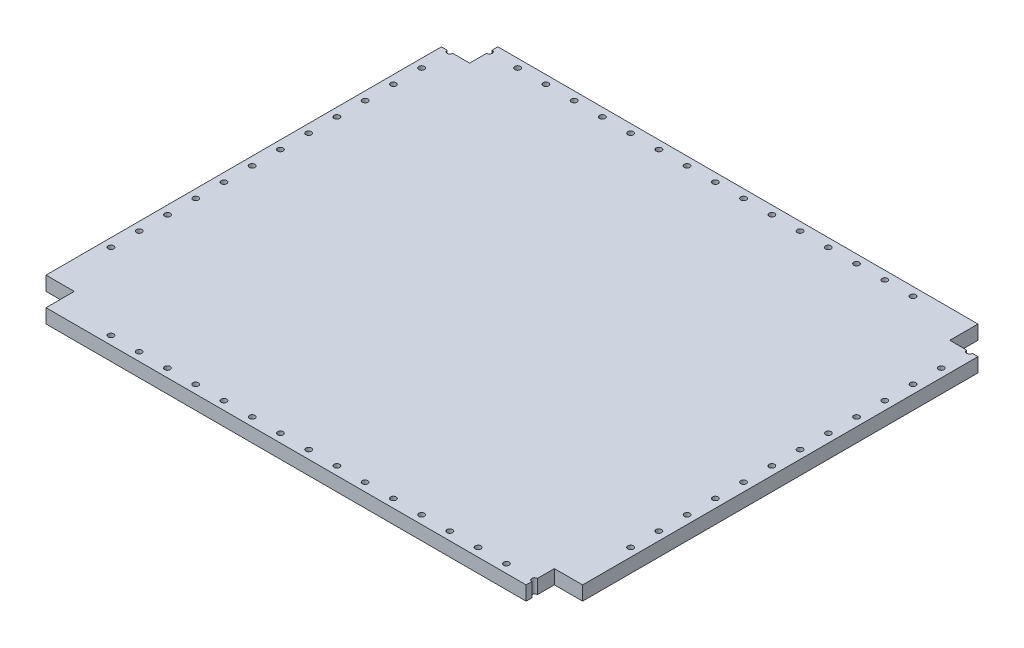
from build123d import *

# Parameters (mm, degrees)
SKETCH1_W           = 482.6
SKETCH1_H           = 406.4
BOSS_EXTRUDE1_DEPTH = 12.7
SKETCH2_R           = 2.5
CUT_EXTRUDE1_DEPTH  = 316.716993524
LPATTERN1_COUNT     = 13
LPATTERN1_PITCH     = 25.4
SKETCH3_R           = 2.5
CUT_EXTRUDE2_DEPTH  = 316.716993524
LPATTERN2_COUNT     = 16
LPATTERN2_PITCH     = 25.4
SKETCH4_R           = 2.5
CUT_EXTRUDE3_DEPTH  = 316.716993524
LPATTERN3_COUNT     = 13
LPATTERN3_PITCH     = 25.4
SKETCH5_R           = 2.5
CUT_EXTRUDE4_DEPTH  = 316.716993524
LPATTERN4_COUNT     = 16
LPATTERN4_PITCH     = 25.4
SKETCH6_W           = 25.4
SKETCH6_H           = 25.4
CUT_EXTRUDE5_DEPTH  = 316.716993524
SKETCH7_W           = 25.4
SKETCH7_H           = 25.4
CUT_EXTRUDE6_DEPTH  = 316.716993524
SKETCH8_W           = 25.4
SKETCH8_H           = 25.4
CUT_EXTRUDE7_DEPTH  = 316.716993524
SKETCH9_W           = 25.4
SKETCH9_H           = 25.4
CUT_EXTRUDE8_DEPTH  = 316.716993524


with BuildPart() as part:
    # Sketch1 → Boss-Extrude1 (new body)
    with BuildSketch(Plane(origin=(0, 0, 0), x_dir=(1, 0, 0), z_dir=(0, 1, 0))):
        Rectangle(SKETCH1_W, SKETCH1_H)
    extrude(amount=BOSS_EXTRUDE1_DEPTH)

    # Sketch2 → Cut-Extrude1 (cut, through all)
    with BuildSketch(Plane(origin=(0, 12.7, 0), x_dir=(1, 0, 0), z_dir=(0, 1, 0))):
        with Locations((-233.68, 177.8)):
            Circle(SKETCH2_R)
    cut_extrude1 = extrude(amount=-CUT_EXTRUDE1_DEPTH, mode=Mode.SUBTRACT)

    # LPattern1: Cut-Extrude1 ×13
    with Locations(*[(0, 0, i * LPATTERN1_PITCH) for i in range(1, LPATTERN1_COUNT)]):
        add(cut_extrude1, mode=Mode.SUBTRACT)

    # Sketch3 → Cut-Extrude2 (cut, through all)
    with BuildSketch(Plane(origin=(0, 12.7, 0), x_dir=(1, 0, 0), z_dir=(0, 1, 0))):
        with Locations((-215.9, 195.58)):
            Circle(SKETCH3_R)
    cut_extrude2 = extrude(amount=-CUT_EXTRUDE2_DEPTH, mode=Mode.SUBTRACT)

    # LPattern2: Cut-Extrude2 ×16
    with Locations(*[(i * LPATTERN2_PITCH, 0, 0) for i in range(1, LPATTERN2_COUNT)]):
        add(cut_extrude2, mode=Mode.SUBTRACT)

    # Sketch4 → Cut-Extrude3 (cut, through all)
    with BuildSketch(Plane(origin=(0, 12.7, 0), x_dir=(1, 0, 0), z_dir=(0, 1, 0))):
        with Locations((233.68, 177.8)):
            Circle(SKETCH4_R)
    cut_extrude3 = extrude(amount=-CUT_EXTRUDE3_DEPTH, mode=Mode.SUBTRACT)

    # LPattern3: Cut-Extrude3 ×13
    with Locations(*[(0, 0, i * LPATTERN3_PITCH) for i in range(1, LPATTERN3_COUNT)]):
        add(cut_extrude3, mode=Mode.SUBTRACT)

    # Sketch5 → Cut-Extrude4 (cut, through all)
    with BuildSketch(Plane(origin=(0, 12.7, 0), x_dir=(1, 0, 0), z_dir=(0, 1, 0))):
        with Locations((215.9, -195.58)):
            Circle(SKETCH5_R)
    cut_extrude4 = extrude(amount=-CUT_EXTRUDE4_DEPTH, mode=Mode.SUBTRACT)

    # LPattern4: Cut-Extrude4 ×16
    with Locations(*[(-i * LPATTERN4_PITCH, 0, 0) for i in range(1, LPATTERN4_COUNT)]):
        add(cut_extrude4, mode=Mode.SUBTRACT)

    # Sketch6 → Cut-Extrude5 (cut, through all)
    with BuildSketch(Plane(origin=(0, 12.7, 0), x_dir=(1, 0, 0), z_dir=(0, 1, 0))):
        with Locations((-228.6, 190.5)):
            Rectangle(SKETCH6_W, SKETCH6_H)
    extrude(amount=-CUT_EXTRUDE5_DEPTH, mode=Mode.SUBTRACT)

    # Sketch7 → Cut-Extrude6 (cut, through all)
    with BuildSketch(Plane(origin=(0, 12.7, 0), x_dir=(1, 0, 0), z_dir=(0, 1, 0))):
        with Locations((-228.6, -190.5)):
            Rectangle(SKETCH7_W, SKETCH7_H)
    extrude(amount=-CUT_EXTRUDE6_DEPTH, mode=Mode.SUBTRACT)

    # Sketch8 → Cut-Extrude7 (cut, through all)
    with BuildSketch(Plane(origin=(0, 12.7, 0), x_dir=(1, 0, 0), z_dir=(0, 1, 0))):
        with Locations((228.6, -190.5)):
            Rectangle(SKETCH8_W, SKETCH8_H)
    extrude(amount=-CUT_EXTRUDE7_DEPTH, mode=Mode.SUBTRACT)

    # Sketch9 → Cut-Extrude8 (cut, through all)
    with BuildSketch(Plane(origin=(0, 12.7, 0), x_dir=(1, 0, 0), z_dir=(0, 1, 0))):
        with Locations((228.6, 190.5)):
            Rectangle(SKETCH9_W, SKETCH9_H)
    extrude(amount=-CUT_EXTRUDE8_DEPTH, mode=Mode.SUBTRACT)


solid = part.part
